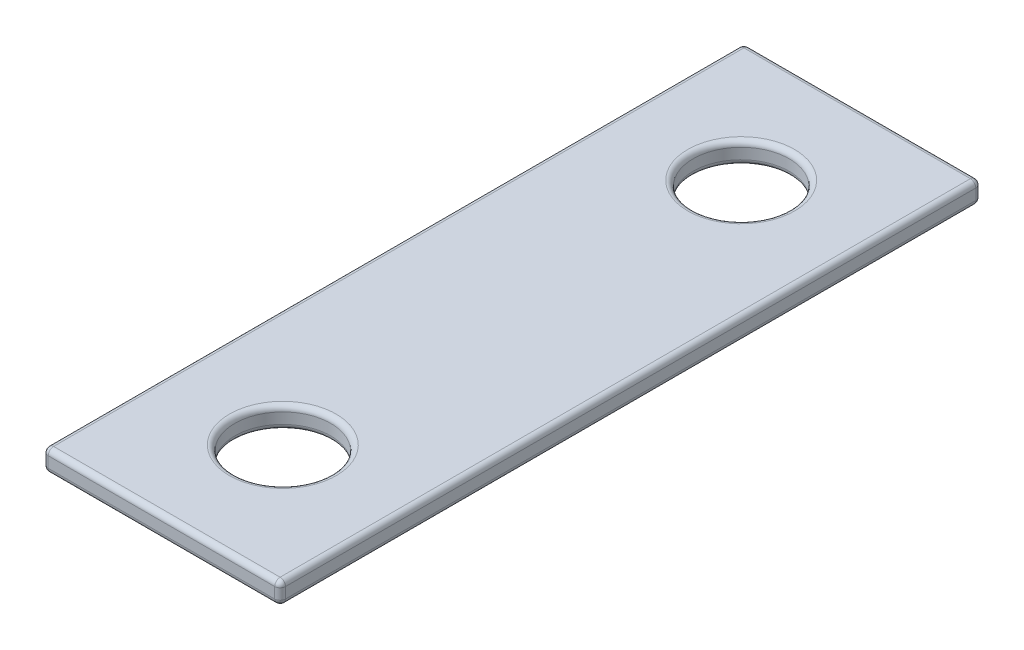
from build123d import *

# Parameters (mm, degrees)
SKETCH1_W           = 5.588
SKETCH1_H           = 16.51
SKETCH1_R           = 1.1303
BOSS_EXTRUDE1_DEPTH = 0.508
FILLET1_R           = 0.127


with BuildPart() as part:
    # Sketch1 → Boss-Extrude1 (new body)
    with BuildSketch(Plane(origin=(0, 0, 0), x_dir=(1, 0, 0), z_dir=(0, 1, 0))):
        with Locations((-3.929784091, -0.598920455)):
            Rectangle(SKETCH1_W, SKETCH1_H)
        with Locations((-3.929784091, 4.798579545)):
            Circle(SKETCH1_R, mode=Mode.SUBTRACT)
        with Locations((-3.929784091, -5.996420455)):
            Circle(SKETCH1_R, mode=Mode.SUBTRACT)
    extrude(amount=BOSS_EXTRUDE1_DEPTH)

    # Fillet1
    fillet1_edges = [part.edges().sort_by_distance(p)[0] for p in [
        (-1.135784091, 0.254, -7.656079545),
        (-6.723784091, 0.254, -7.656079545),
        (-3.929784091, 0.508, -7.656079545),
        (-3.929784091, 0, -7.656079545),
        (-6.723784091, 0, 0.598920455),
        (-1.135784091, 0, 0.598920455),
        (-1.135784091, 0.508, 0.598920455),
        (-6.723784091, 0.508, 0.598920455),
        (-3.929784091, 0.508, 8.853920455),
        (-3.929784091, 0, 8.853920455),
        (-6.723784091, 0.254, 8.853920455),
        (-1.135784091, 0.254, 8.853920455),
        (-5.060084091, 0, -4.798579545),
        (-5.060084091, 0.508, -4.798579545),
        (-5.060084091, 0, 5.996420455),
        (-5.060084091, 0.508, 5.996420455),
    ]]
    fillet(fillet1_edges, radius=FILLET1_R)


solid = part.part
